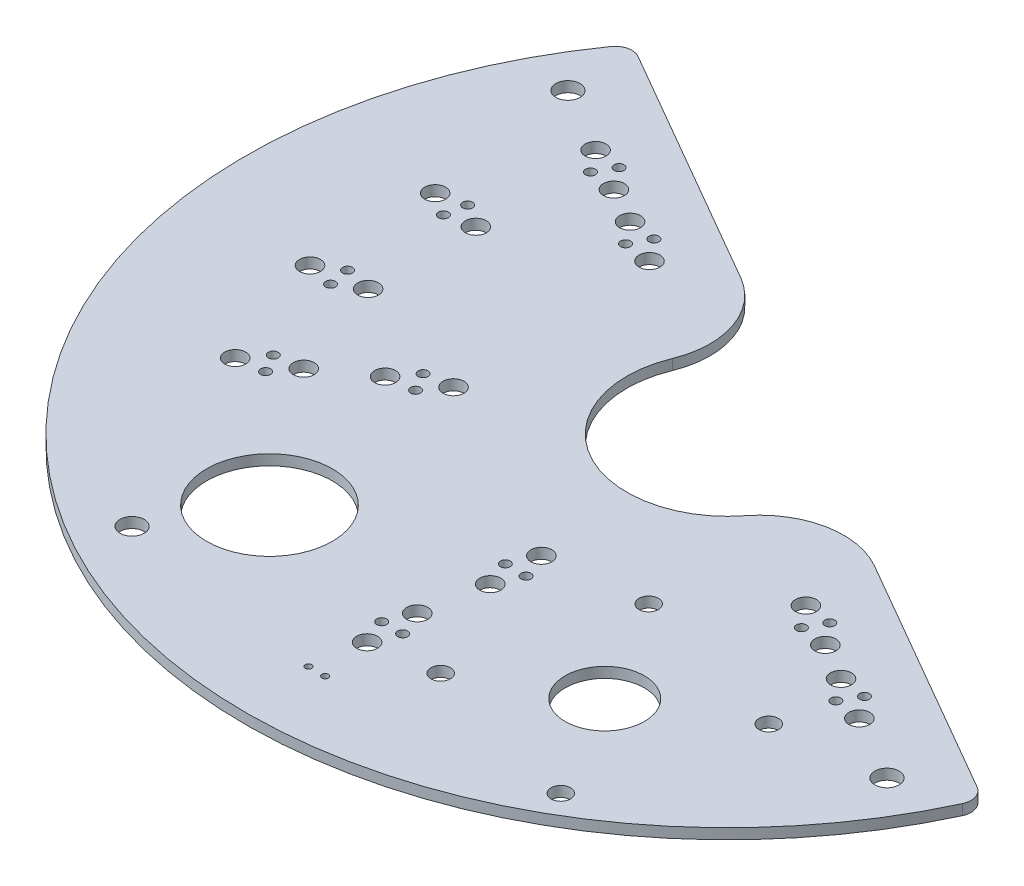
from build123d import *

# Parameters (mm, degrees)
SKETCH1_R           = 73.025
SKETCH1_R_2         = 15.24
SKETCH1_R_3         = 0.75
SKETCH1_R_4         = 1.585
SKETCH1_R_5         = 20
SKETCH1_R_6         = 9.525
SKETCH1_R_7         = 6
BOSS_EXTRUDE1_DEPTH = 1.5875
SKETCH2_R           = 1.8288
CUT_EXTRUDE1_DEPTH  = 104.285146107
CUT_EXTRUDE2_DEPTH  = 104.285146107
FILLET1_R           = 12.7
FILLET2_R           = 2.54
SKETCH4_R           = 0.4953
CUT_EXTRUDE3_DEPTH  = 104.285146107
SKETCH5_R           = 0.4953
SKETCH5_R_2         = 0.75
BOSS_EXTRUDE2_DEPTH = 0.1016
SKETCH6_R           = 1.4732
CUT_EXTRUDE4_DEPTH  = 104.285146107


with BuildPart() as part:
    # Sketch1 → Boss-Extrude1 (new body)
    with BuildSketch(Plane(origin=(0, 0, 0), x_dir=(1, 0, 0), z_dir=(0, 1, 0))):
        Circle(SKETCH1_R)
        Circle(SKETCH1_R_2, mode=Mode.SUBTRACT)
        with Locations((-1.585, 50.8)):
            Circle(SKETCH1_R_3, mode=Mode.SUBTRACT)
        with Locations((1.585, 50.8)):
            Circle(SKETCH1_R_3, mode=Mode.SUBTRACT)
        with Locations((0, 54.6)):
            Circle(SKETCH1_R_4, mode=Mode.SUBTRACT)
        with Locations((0, 47)):
            Circle(SKETCH1_R_4, mode=Mode.SUBTRACT)
        with Locations((47.284987047, 27.3)):
            Circle(SKETCH1_R_4, mode=Mode.SUBTRACT)
        with Locations((43.201590512, 26.772650265)):
            Circle(SKETCH1_R_3, mode=Mode.SUBTRACT)
        with Locations((44.786590512, 24.027349735)):
            Circle(SKETCH1_R_3, mode=Mode.SUBTRACT)
        with Locations((40.703193978, 23.5)):
            Circle(SKETCH1_R_4, mode=Mode.SUBTRACT)
        with Locations((47.284987047, -27.3)):
            Circle(SKETCH1_R_4, mode=Mode.SUBTRACT)
        with Locations((44.786590512, -24.027349735)):
            Circle(SKETCH1_R_3, mode=Mode.SUBTRACT)
        with Locations((43.201590512, -26.772650265)):
            Circle(SKETCH1_R_3, mode=Mode.SUBTRACT)
        with Locations((40.703193978, -23.5)):
            Circle(SKETCH1_R_4, mode=Mode.SUBTRACT)
        with Locations((0, -54.6)):
            Circle(SKETCH1_R_4, mode=Mode.SUBTRACT)
        with Locations((1.585, -50.8)):
            Circle(SKETCH1_R_3, mode=Mode.SUBTRACT)
        with Locations((-1.585, -50.8)):
            Circle(SKETCH1_R_3, mode=Mode.SUBTRACT)
        with Locations((0, -47)):
            Circle(SKETCH1_R_4, mode=Mode.SUBTRACT)
        with Locations((-47.284987047, -27.3)):
            Circle(SKETCH1_R_4, mode=Mode.SUBTRACT)
        with Locations((-43.201590512, -26.772650265)):
            Circle(SKETCH1_R_3, mode=Mode.SUBTRACT)
        with Locations((-44.786590512, -24.027349735)):
            Circle(SKETCH1_R_3, mode=Mode.SUBTRACT)
        with Locations((-40.703193978, -23.5)):
            Circle(SKETCH1_R_4, mode=Mode.SUBTRACT)
        with Locations((-47.284987047, 27.3)):
            Circle(SKETCH1_R_4, mode=Mode.SUBTRACT)
        with Locations((-44.786590512, 24.027349735)):
            Circle(SKETCH1_R_3, mode=Mode.SUBTRACT)
        with Locations((-43.201590512, 26.772650265)):
            Circle(SKETCH1_R_3, mode=Mode.SUBTRACT)
        with Locations((-40.703193978, 23.5)):
            Circle(SKETCH1_R_4, mode=Mode.SUBTRACT)
        with Locations((25.4, 43.994090512)):
            Circle(SKETCH1_R_5, mode=Mode.SUBTRACT)
        with Locations((-25.4, -43.994090512)):
            Circle(SKETCH1_R_6, mode=Mode.SUBTRACT)
        with Locations((25.4, -43.994090512)):
            Circle(SKETCH1_R_7, mode=Mode.SUBTRACT)
        with Locations((-46.285964392, 8.16146435)):
            Circle(SKETCH1_R_4, mode=Mode.SUBTRACT)
        with Locations((-50.303466215, 7.260407137)):
            Circle(SKETCH1_R_3, mode=Mode.SUBTRACT)
        with Locations((-49.753001491, 10.382247714)):
            Circle(SKETCH1_R_3, mode=Mode.SUBTRACT)
        with Locations((-53.770503314, 9.481190501)):
            Circle(SKETCH1_R_4, mode=Mode.SUBTRACT)
        with Locations((-46.285964392, -8.16146435)):
            Circle(SKETCH1_R_4, mode=Mode.SUBTRACT)
        with Locations((-49.753001491, -10.382247714)):
            Circle(SKETCH1_R_3, mode=Mode.SUBTRACT)
        with Locations((-50.303466215, -7.260407137)):
            Circle(SKETCH1_R_3, mode=Mode.SUBTRACT)
        with Locations((-53.770503314, -9.481190501)):
            Circle(SKETCH1_R_4, mode=Mode.SUBTRACT)
        with Locations((-29.397305699, -17.855276467)):
            Circle(SKETCH1_R_3, mode=Mode.SUBTRACT)
        with Locations((-31.002036221, -15.116847022)):
            Circle(SKETCH1_R_3, mode=Mode.SUBTRACT)
        with Locations((-33.503208801, -18.377965576)):
            Circle(SKETCH1_R_4, mode=Mode.SUBTRACT)
        with Locations((-26.914267425, -14.590346807)):
            Circle(SKETCH1_R_4, mode=Mode.SUBTRACT)
        with Locations((0.18310412, -33.841026905)):
            Circle(SKETCH1_R_3, mode=Mode.SUBTRACT)
        with Locations((3.356893615, -33.875899805)):
            Circle(SKETCH1_R_3, mode=Mode.SUBTRACT)
        with Locations((1.849768537, -30.052376234)):
            Circle(SKETCH1_R_4, mode=Mode.SUBTRACT)
        with Locations((1.702835812, -37.650969207)):
            Circle(SKETCH1_R_4, mode=Mode.SUBTRACT)
        with Locations((30.985856532, -19.788486735)):
            Circle(SKETCH1_R_3, mode=Mode.SUBTRACT)
        with Locations((32.50665139, -17.002568775)):
            Circle(SKETCH1_R_3, mode=Mode.SUBTRACT)
        with Locations((28.42312809, -16.538245649)):
            Circle(SKETCH1_R_4, mode=Mode.SUBTRACT)
        with Locations((35.063306729, -20.235302863)):
            Circle(SKETCH1_R_4, mode=Mode.SUBTRACT)
        with Locations((-32.704469206, 17.259289581)):
            Circle(SKETCH1_R_3, mode=Mode.SUBTRACT)
        with Locations((-31.183674349, 20.045207541)):
            Circle(SKETCH1_R_3, mode=Mode.SUBTRACT)
        with Locations((-35.267197648, 20.509530667)):
            Circle(SKETCH1_R_4, mode=Mode.SUBTRACT)
        with Locations((-28.627019009, 16.812473453)):
            Circle(SKETCH1_R_4, mode=Mode.SUBTRACT)
    extrude(amount=-BOSS_EXTRUDE1_DEPTH)

    # Sketch2 → Cut-Extrude1 (cut, through all)
    with BuildSketch(Plane(origin=(0, 0, 0), x_dir=(1, 0, 0), z_dir=(0, 1, 0))):
        with Locations((-57.192317666, 33.02)):
            Circle(SKETCH2_R)
        with Locations((33.02, 57.192317666)):
            Circle(SKETCH2_R)
        with Locations((57.192317666, -33.02)):
            Circle(SKETCH2_R)
        with Locations((-33.02, -57.192317666)):
            Circle(SKETCH2_R)
    extrude(amount=-CUT_EXTRUDE1_DEPTH, mode=Mode.SUBTRACT)

    # Sketch3 → Cut-Extrude2 (cut, through all)
    with BuildSketch(Plane(origin=(0, 0, 0), x_dir=(1, 0, 0), z_dir=(0, 1, 0))):
        with BuildLine():
            Line((-59.533825484, 44.637157955), (68.423825484, -29.239226276))
            ThreePointArc((68.423825484, -29.239226276), (37.204677955, 64.440392498), (-59.533825484, 44.637157955))
        make_face()
    extrude(amount=-CUT_EXTRUDE2_DEPTH, mode=Mode.SUBTRACT)

    # Fillet1
    fillet1_edges = [part.edges().sort_by_distance(p)[0] for p in [
        (15.165033815, -0.79375, -1.509751431),
        (-6.275033815, -0.79375, -13.888180249),
    ]]
    fillet(fillet1_edges, radius=FILLET1_R)

    # Fillet2
    fillet2_edges = [part.edges().sort_by_distance(p)[0] for p in [
        (67.216123088, -0.79375, 28.541958973),
        (-58.326123088, -0.79375, -43.939890652),
    ]]
    fillet(fillet2_edges, radius=FILLET2_R)

    # Sketch4 → Cut-Extrude3 (cut, through all)
    with BuildSketch(Plane(origin=(0, 0, 0), x_dir=(1, 0, 0), z_dir=(0, 1, 0))):
        with Locations((1.27, -62.23)):
            Circle(SKETCH4_R)
        with Locations((-1.27, -62.23)):
            Circle(SKETCH4_R)
    extrude(amount=-CUT_EXTRUDE3_DEPTH, mode=Mode.SUBTRACT)

    # Sketch5 → Boss-Extrude2 (add)
    # profile 1 of 10: a face of its own
    with BuildSketch(Plane.XZ.offset(1.5875)):
        with BuildLine():
            Line((34.490720839, 15.234132112), (45.023794735, 21.301797022))
            ThreePointArc((45.023794735, 21.301797022), (44.640302422, 22.09416322), (44.242866733, 22.879628318))
            ThreePointArc((44.242866733, 22.879628318), (44.194605568, 25.15093944), (46.040660753, 23.82683083))
            ThreePointArc((46.040660753, 23.82683083), (46.421042895, 23.076981746), (46.789213502, 22.321062023))
            Line((46.789213502, 22.321062023), (54.774266163, 26.931234326))
            ThreePointArc((54.774266163, 26.931234326), (32.789239067, 51.481816376), (1.245393112, 61.024262486))
            ThreePointArc((1.245393112, 61.024262486), (0.064262486, 62.254606888), (1.294606888, 63.435737514))
            ThreePointArc((1.294606888, 63.435737514), (34.873073505, 53.006014236), (57.7422016, 26.298421156))
            Line((57.7422016, 26.298421156), (28.012465947, 9.133950273))
            ThreePointArc((28.012465947, 9.133950273), (-12.042501731, 20.858224848), (-21.916465947, -19.692531996))
            Line((-21.916465947, -19.692531996), (-41.53590206, -31.019818717))
            ThreePointArc((-41.53590206, -31.019818717), (-42.622921376, -29.508420604), (-43.654971216, -27.958966385))
            ThreePointArc((-43.654971216, -27.958966385), (-43.878655247, -25.698181398), (-41.935772719, -26.875632368))
            ThreePointArc((-41.935772719, -26.875632368), (-41.454257835, -27.61255432), (-40.959794735, -28.340851504))
            Line((-40.959794735, -28.340851504), (-30.537815121, -22.27790388))
            Line((-30.537815121, -22.27790388), (-31.053590427, -21.385433264))
            ThreePointArc((-31.053590427, -21.385433264), (-31.761936541, -19.017766992), (-30.06523382, -20.814652539))
            Line((-30.06523382, -20.814652539), (-29.551271602, -21.703985881))
            Line((-29.551271602, -21.703985881), (-25.045535575, -19.082790815))
            ThreePointArc((-25.045535575, -19.082790815), (-13.264226318, 23.017060497), (29.071086472, 12.112106614))
            Line((29.071086472, 12.112106614), (33.500885608, 14.663929286))
            ThreePointArc((33.500885608, 14.663929286), (33.174864003, 15.236775822), (32.841290582, 15.805258023))
            ThreePointArc((32.841290582, 15.805258023), (31.60714545, 17.921497395), (33.747259191, 16.729232129))
            ThreePointArc((33.747259191, 16.729232129), (34.125009903, 15.984675603), (34.490720839, 15.234132112))
        make_face()
        with Locations((1.27, 62.23)):
            Circle(SKETCH5_R, mode=Mode.SUBTRACT)
        with Locations((44.786590512, 24.027349735)):
            Circle(SKETCH5_R_2, mode=Mode.SUBTRACT)
        with Locations((-43.201590512, -26.772650265)):
            Circle(SKETCH5_R_2, mode=Mode.SUBTRACT)
        with Locations((-31.173750375, -20.038911028)):
            Circle(SKETCH5_R_2, mode=Mode.SUBTRACT)
        with Locations((32.507430232, 16.993318336)):
            Circle(SKETCH5_R_2, mode=Mode.SUBTRACT)
    # profile 2 of 10: a face of its own
    with BuildSketch(Plane.XZ.offset(1.5875)):
        with BuildLine():
            Line((33.336492348, 26.169869047), (41.535902035, 31.019818701))
            ThreePointArc((41.535902035, 31.019818701), (42.622921339, 29.508420605), (43.654971168, 27.958966404))
            ThreePointArc((43.654971168, 27.958966404), (43.878655268, 25.698181412), (41.935772719, 26.875632368))
            ThreePointArc((41.935772719, 26.875632368), (41.454257835, 27.61255432), (40.959794735, 28.340851504))
            Line((40.959794735, 28.340851504), (32.479535914, 23.822017232))
            ThreePointArc((32.479535914, 23.822017232), (19.997147631, 34.964594161), (4.064, 40.073590583))
            Line((4.064, 40.073590583), (4.064, 49.642648525))
            ThreePointArc((4.064, 49.642648525), (3.186044586, 49.706717539), (2.307094012, 49.755260685))
            ThreePointArc((2.307094012, 49.755260685), (0.3159503, 50.849120845), (2.385689572, 51.785797245))
            ThreePointArc((2.385689572, 51.785797245), (4.243581194, 51.666742975), (6.095999999, 51.48105569))
            Line((6.095999999, 51.48105569), (6.095999999, 41.940702808))
            ThreePointArc((6.095999999, 41.940702808), (21.234645336, 36.677971665), (33.336492348, 26.169869047))
        make_face()
        with Locations((1.585, 50.8)):
            Circle(SKETCH5_R_2, mode=Mode.SUBTRACT)
        with Locations((43.201590512, 26.772650265)):
            Circle(SKETCH5_R_2, mode=Mode.SUBTRACT)
    # profile 3 of 10: a face of its own
    with BuildSketch(Plane.XZ.offset(1.5875)):
        with BuildLine():
            Line((-6.095999999, 38.638067239), (-6.095999999, 51.481055694))
            ThreePointArc((-6.095999999, 51.481055694), (-4.243581193, 51.666742978), (-2.38568957, 51.785797247))
            ThreePointArc((-2.38568957, 51.785797247), (-0.3159503, 50.849120844), (-2.307094012, 49.755260685))
            ThreePointArc((-2.307094012, 49.755260685), (-3.186044586, 49.706717539), (-4.064, 49.642648525))
            Line((-4.064, 49.642648525), (-4.064, 36.860642425))
            ThreePointArc((-4.064, 36.860642425), (-18.542, 32.115686074), (-29.89025274, 21.949848454))
            Line((-29.89025274, 21.949848454), (-40.959794734, 28.340851504))
            ThreePointArc((-40.959794734, 28.340851504), (-41.454257834, 27.612554318), (-41.935772719, 26.875632366))
            ThreePointArc((-41.935772719, 26.875632366), (-43.878655251, 25.698181402), (-43.654971208, 27.958966388))
            ThreePointArc((-43.654971208, 27.958966388), (-42.622921369, 29.508420604), (-41.535902055, 31.019818714))
            Line((-41.535902055, 31.019818714), (-30.413547783, 24.598324481))
            ThreePointArc((-30.413547783, 24.598324481), (-19.558, 33.875449694), (-6.095999999, 38.638067239))
        make_face()
        with Locations((-1.585, 50.8)):
            Circle(SKETCH5_R_2, mode=Mode.SUBTRACT)
        with Locations((-43.201590512, 26.772650265)):
            Circle(SKETCH5_R_2, mode=Mode.SUBTRACT)
    # profile 4 of 10: a face of its own
    with BuildSketch(Plane.XZ.offset(1.5875)):
        with BuildLine():
            ThreePointArc((-1.137328397, 61.026372169), (-0.059313178, 62.253645904), (-1.184427719, 63.437890349))
            ThreePointArc((-1.184427719, 63.437890349), (-54.638937722, 32.254538991), (-56.114446604, -29.613133627))
            ThreePointArc((-56.114446604, -29.613133627), (-54.535716158, -29.885091506), (-54.048929792, -28.358857598))
            ThreePointArc((-54.048929792, -28.358857598), (-52.52438099, 31.091815927), (-1.137328397, 61.026372169))
        make_face()
        with Locations((-1.27, 62.23)):
            Circle(SKETCH5_R, mode=Mode.SUBTRACT)
    # profile 5 of 10: a face of its own
    with BuildSketch(Plane.XZ.offset(1.5875)):
        with BuildLine():
            ThreePointArc((-48.598743805, -10.911954419), (-50.021744231, -9.141007471), (-50.584784003, -11.341954885))
            ThreePointArc((-50.584784003, -11.341954885), (-48.714342612, -17.730570692), (-46.040660761, -23.826830882))
            ThreePointArc((-46.040660761, -23.826830882), (-44.194605546, -25.150939428), (-44.242866733, -22.879628318))
            ThreePointArc((-44.242866733, -22.879628318), (-46.804887207, -17.035585761), (-48.598743805, -10.911954419))
        make_face()
        with Locations((-49.753001492, -10.382247714)):
            Circle(SKETCH5_R_2, mode=Mode.SUBTRACT)
        with Locations((-44.786590512, -24.027349735)):
            Circle(SKETCH5_R_2, mode=Mode.SUBTRACT)
    # profile 6 of 10: a face of its own
    with BuildSketch(Plane.XZ.offset(1.5875)):
        with BuildLine():
            ThreePointArc((-51.413325287, -6.643063764), (-50.131472618, -8.518706864), (-49.399989147, -6.367866276))
            ThreePointArc((-49.399989147, -6.367866276), (-49.808720609, 0), (-49.399989147, 6.367866277))
            ThreePointArc((-49.399989147, 6.367866277), (-50.131472619, 8.518706864), (-51.413325286, 6.643063762))
            ThreePointArc((-51.413325286, 6.643063762), (-51.840720608, -1e-09), (-51.413325287, -6.643063764))
        make_face()
        with Locations((-50.303466215, 7.260407137)):
            Circle(SKETCH5_R_2, mode=Mode.SUBTRACT)
        with Locations((-50.303466215, -7.260407137)):
            Circle(SKETCH5_R_2, mode=Mode.SUBTRACT)
    # profile 7 of 10: a face of its own
    with BuildSketch(Plane.XZ.offset(1.5875)):
        with BuildLine():
            ThreePointArc((-50.584784, 11.341954887), (-50.021744233, 9.141007472), (-48.598743805, 10.911954418))
            ThreePointArc((-48.598743805, 10.911954418), (-46.804887206, 17.035585761), (-44.242866731, 22.879628319))
            ThreePointArc((-44.242866731, 22.879628319), (-44.194605549, 25.15093943), (-46.04066076, 23.826830875))
            ThreePointArc((-46.04066076, 23.826830875), (-46.866502555, 22.158322389), (-47.631902057, 20.461236993))
            ThreePointArc((-47.631902057, 20.461236993), (-49.319566924, 15.96999159), (-50.584784, 11.341954887))
        make_face()
        with Locations((-44.786590512, 24.027349735)):
            Circle(SKETCH5_R_2, mode=Mode.SUBTRACT)
        with Locations((-49.753001492, 10.382247714)):
            Circle(SKETCH5_R_2, mode=Mode.SUBTRACT)
    # profile 8 of 10: a face of its own
    with BuildSketch(Plane.XZ.offset(1.5875)):
        with BuildLine():
            ThreePointArc((29.750286049, 20.294824353), (31.818786572, 18.884056056), (30.842384069, 21.189614503))
            ThreePointArc((30.842384069, 21.189614503), (19.436792184, 31.341447854), (4.523593019, 34.619211922))
            ThreePointArc((4.523593019, 34.619211922), (2.183689823, 33.970896872), (4.484099362, 33.193995769))
            ThreePointArc((4.484099362, 33.193995769), (18.709722164, 29.863769073), (29.750286049, 20.294824353))
        make_face()
        with Locations((3.354949812, 33.875033472)):
            Circle(SKETCH5_R_2, mode=Mode.SUBTRACT)
        with Locations((30.984541636, 19.78920211)):
            Circle(SKETCH5_R_2, mode=Mode.SUBTRACT)
    # profile 9 of 10: a face of its own
    with BuildSketch(Plane.XZ.offset(1.5875)):
        with BuildLine():
            ThreePointArc((-0.892844209, 32.974481926), (1.313564772, 33.515723797), (-0.44322017, 34.956171651))
            ThreePointArc((-0.44322017, 34.956171651), (-16.808276637, 30.222831543), (-29.697033, 19.082834184))
            ThreePointArc((-29.697033, 19.082834184), (-30.254991066, 16.880593019), (-28.158390528, 17.75549275))
            ThreePointArc((-28.158390528, 17.75549275), (-16.302373049, 28.548130039), (-0.892844209, 32.974481926))
        make_face()
        with Locations((-29.39844648, 17.849058536)):
            Circle(SKETCH5_R_2, mode=Mode.SUBTRACT)
        with Locations((0.184301483, 33.838710291)):
            Circle(SKETCH5_R_2, mode=Mode.SUBTRACT)
    # profile 10 of 10: a face of its own
    with BuildSketch(Plane.XZ.offset(1.5875)):
        with BuildLine():
            ThreePointArc((-31.336769265, 13.038282839), (-30.328093766, 16.217420137), (-32.984953468, 14.201127316))
            ThreePointArc((-32.984953468, 14.201127316), (-33.66330563, 12.920695881), (-34.330413979, 11.634370586))
            ThreePointArc((-34.330413979, 11.634370586), (-37.669342414, -2.643171748), (-33.915331162, -16.817234599))
            ThreePointArc((-33.915331162, -16.817234599), (-32.492330711, -18.588181541), (-31.929291004, -16.3872341))
            ThreePointArc((-31.929291004, -16.3872341), (-32.27952678, -15.643177599), (-32.64152132, -14.904770442))
            ThreePointArc((-32.64152132, -14.904770442), (-35.634138362, -0.763047218), (-31.336769265, 13.038282839))
        make_face()
        with Locations((-32.718295999, -17.260138496)):
            Circle(SKETCH5_R_2, mode=Mode.SUBTRACT)
        with Locations((-31.007036728, 15.122901043)):
            Circle(SKETCH5_R_2, mode=Mode.SUBTRACT)
    extrude(amount=BOSS_EXTRUDE2_DEPTH)

    # Sketch6 → Cut-Extrude4 (cut, through all)
    with BuildSketch(Plane.XZ.offset(1.5875)):
        with Locations((34.496852839, 59.750301818)):
            Circle(SKETCH6_R)
        with Locations((9.643788694, 53.090943351)):
            Circle(SKETCH6_R)
        with Locations((16.303147161, 28.237879206)):
            Circle(SKETCH6_R)
        with Locations((41.156211306, 34.897237673)):
            Circle(SKETCH6_R)
    extrude(amount=-CUT_EXTRUDE4_DEPTH, mode=Mode.SUBTRACT)


solid = part.part
